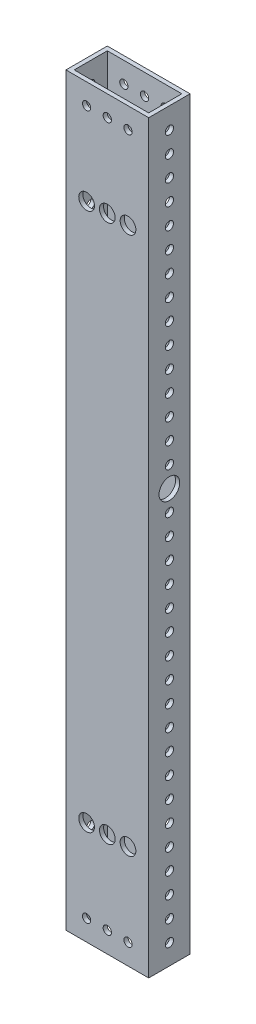
from build123d import *

# Parameters (mm, degrees)
SKETCH1_W           = 50.8
SKETCH1_H           = 25.4
SKETCH1_W_2         = 45.72
SKETCH1_H_2         = 20.32
BOSS_EXTRUDE1_DEPTH = 457.2
SKETCH3_R           = 2.54
SKETCH3_R_2         = 6.35
CUT_EXTRUDE1_DEPTH  = 457.2
SKETCH4_R           = 2.54
SKETCH4_R_2         = 4.826
CUT_EXTRUDE3_DEPTH  = 457.2
SKETCH5_R           = 2.54
CUT_EXTRUDE4_DEPTH  = 2.54


with BuildPart() as part:
    # Sketch1 → Boss-Extrude1 (new body)
    with BuildSketch(Plane(origin=(0, 0, 0), x_dir=(1, 0, 0), z_dir=(0, 1, 0))):
        with Locations((-21.472101782, 11.503789329)):
            Rectangle(SKETCH1_W, SKETCH1_H)
        with Locations((-21.472101782, 11.503789329)):
            Rectangle(SKETCH1_W_2, SKETCH1_H_2, mode=Mode.SUBTRACT)
    extrude(amount=BOSS_EXTRUDE1_DEPTH)

    # Sketch3 → Cut-Extrude1 (cut)
    with BuildSketch(Plane(origin=(3.927898218, 0, 0), x_dir=(0, 0, -1), z_dir=(1, 0, 0))):
        with Locations((11.503789329, 444.246)):
            Circle(SKETCH3_R)
        with Locations((11.503789329, 431.546)):
            Circle(SKETCH3_R)
        with Locations((11.503789329, 418.846)):
            Circle(SKETCH3_R)
        with Locations((11.503789329, 406.146)):
            Circle(SKETCH3_R)
        with Locations((11.503789329, 393.446)):
            Circle(SKETCH3_R)
        with Locations((11.503789329, 380.746)):
            Circle(SKETCH3_R)
        with Locations((11.503789329, 368.046)):
            Circle(SKETCH3_R)
        with Locations((11.503789329, 355.346)):
            Circle(SKETCH3_R)
        with Locations((11.503789329, 342.646)):
            Circle(SKETCH3_R)
        with Locations((11.503789329, 329.946)):
            Circle(SKETCH3_R)
        with Locations((11.503789329, 317.246)):
            Circle(SKETCH3_R)
        with Locations((11.503789329, 304.546)):
            Circle(SKETCH3_R)
        with Locations((11.503789329, 291.846)):
            Circle(SKETCH3_R)
        with Locations((11.503789329, 279.146)):
            Circle(SKETCH3_R)
        with Locations((11.503789329, 266.446)):
            Circle(SKETCH3_R)
        with Locations((11.503789329, 241.046)):
            Circle(SKETCH3_R)
        with Locations((11.503789329, 228.346)):
            Circle(SKETCH3_R)
        with Locations((11.503789329, 215.646)):
            Circle(SKETCH3_R)
        with Locations((11.503789329, 202.946)):
            Circle(SKETCH3_R)
        with Locations((11.503789329, 190.246)):
            Circle(SKETCH3_R)
        with Locations((11.503789329, 177.546)):
            Circle(SKETCH3_R)
        with Locations((11.503789329, 164.846)):
            Circle(SKETCH3_R)
        with Locations((11.503789329, 152.146)):
            Circle(SKETCH3_R)
        with Locations((11.503789329, 139.446)):
            Circle(SKETCH3_R)
        with Locations((11.503789329, 126.746)):
            Circle(SKETCH3_R)
        with Locations((11.503789329, 114.046)):
            Circle(SKETCH3_R)
        with Locations((11.503789329, 101.346)):
            Circle(SKETCH3_R)
        with Locations((11.503789329, 88.646)):
            Circle(SKETCH3_R)
        with Locations((11.503789329, 75.946)):
            Circle(SKETCH3_R)
        with Locations((11.503789329, 63.246)):
            Circle(SKETCH3_R)
        with Locations((11.503789329, 50.546)):
            Circle(SKETCH3_R)
        with Locations((11.503789329, 37.846)):
            Circle(SKETCH3_R)
        with Locations((11.503789329, 25.146)):
            Circle(SKETCH3_R)
        with Locations((11.503789329, 12.446)):
            Circle(SKETCH3_R)
        with Locations((11.503789329, 253.746)):
            Circle(SKETCH3_R_2)
    extrude(amount=-CUT_EXTRUDE1_DEPTH, mode=Mode.SUBTRACT)

    # Sketch4 → Cut-Extrude3 (cut)
    with BuildSketch(Plane(origin=(0, 0, -24.203789329), x_dir=(-1, 0, 0), z_dir=(0, 0, -1))):
        with Locations((34.172101782, 444.5)):
            Circle(SKETCH4_R)
        with Locations((21.472101782, 444.5)):
            Circle(SKETCH4_R)
        with Locations((8.772101782, 444.5)):
            Circle(SKETCH4_R)
        with Locations((8.772101782, 393.7)):
            Circle(SKETCH4_R_2)
        with Locations((21.472101782, 393.7)):
            Circle(SKETCH4_R_2)
        with Locations((34.172101782, 393.7)):
            Circle(SKETCH4_R_2)
        with Locations((34.172101782, 12.7)):
            Circle(SKETCH4_R)
        with Locations((21.472101782, 12.7)):
            Circle(SKETCH4_R)
        with Locations((8.772101782, 12.7)):
            Circle(SKETCH4_R)
        with Locations((34.172101782, 63.5)):
            Circle(SKETCH4_R_2)
        with Locations((21.472101782, 63.5)):
            Circle(SKETCH4_R_2)
        with Locations((8.772101782, 63.5)):
            Circle(SKETCH4_R_2)
    extrude(amount=-CUT_EXTRUDE3_DEPTH, mode=Mode.SUBTRACT)

    # Sketch5 → Cut-Extrude4 (cut)
    with BuildSketch(Plane(origin=(0, 0, -24.203789329), x_dir=(-1, 0, 0), z_dir=(0, 0, -1))):
        with Locations((34.426101782, 240.77667004)):
            Circle(SKETCH5_R)
        with Locations((34.426101782, 266.17667004)):
            Circle(SKETCH5_R)
    extrude(amount=-CUT_EXTRUDE4_DEPTH, mode=Mode.SUBTRACT)


solid = part.part
